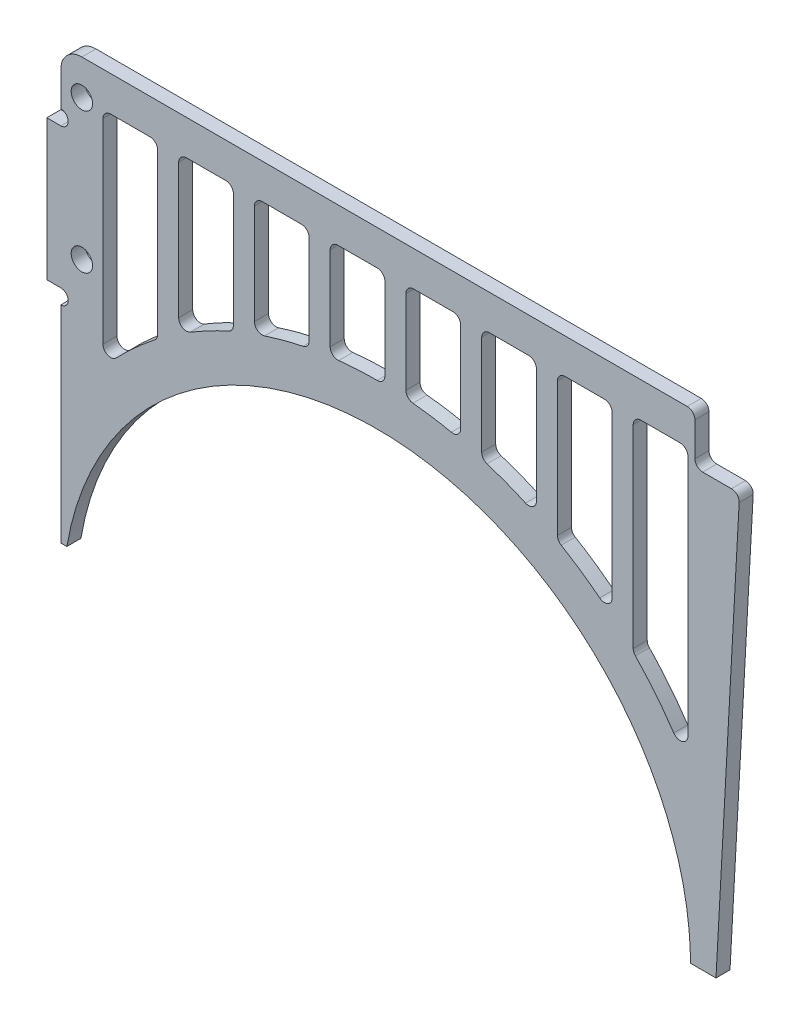
from build123d import *

# Parameters (mm, degrees)
SKETCH_1_W          = 100
SKETCH_1_H          = 68.5
EXTRUDE_1_DEPTH     = 2
SKETCH_2_RX         = 44.75
SKETCH_2_RY         = 43.805404359
CUT_EXTRUDE_1_DEPTH = 2
CUT_EXTRUDE_2_DEPTH = 2
CUT_EXTRUDE_3_DEPTH = 22
CUT_EXTRUDE_4_DEPTH = 22
SKETCH_7_W          = 4
SKETCH_7_H          = 20
EXTRUDE_2_DEPTH     = 2
SKETCH_8_R          = 1.05
CUT_EXTRUDE_5_DEPTH = 2
SKETCH_9_R          = 1.525
CUT_EXTRUDE_6_DEPTH = 10
CUT_EXTRUDE_7_DEPTH = 10
EXTRUDE_3_DEPTH     = 2
EXTRUDE_START       = -2
EXTRUDE_4_DEPTH     = 2
EXTRUDE_5_DEPTH     = 2
EXTRUDE_6_DEPTH     = 2
FILLET_1_R          = 1.1
FILLET_2_R          = 3
SKETCH_15_W         = 7.281373481
SKETCH_15_H         = 7
CUT_EXTRUDE_8_DEPTH = 2
FILLET_3_R          = 1.1


# Read off the part's stored shape, not the designer's step: 凸台-拉伸4, 凸台-拉伸6
with BuildPart() as part:
    # 草图1 → 凸台-拉伸1 (new body)
    with BuildSketch(Plane.XY):
        Rectangle(SKETCH_1_W, SKETCH_1_H)
    extrude(amount=EXTRUDE_1_DEPTH)

    # 草图2 → 切除-拉伸1 (cut)
    with BuildSketch(Plane(origin=(0, 0, 0), x_dir=(-1, 0, 0), z_dir=(0, 0, -1))):
        with Locations(Location((4.999964, -34.437161735), (0, 0, 0))):
            Ellipse(SKETCH_2_RX, SKETCH_2_RY)
    extrude(amount=-CUT_EXTRUDE_1_DEPTH, mode=Mode.SUBTRACT)

    # 草图4 → 切除-拉伸2 (cut)
    with BuildSketch(Plane(origin=(0, 0, 0), x_dir=(-1, 0, 0), z_dir=(0, 0, -1))):
        Polygon((-47.655358824, 34.25), (-47.706198649, 35.178355106), (-50, 34.25), (-50, -34.25), align=None)
    extrude(amount=-CUT_EXTRUDE_2_DEPTH, mode=Mode.SUBTRACT)

    # 草图5 → 切除-拉伸3 (cut)
    with BuildSketch(Plane.XY.offset(2)):
        Polygon((43.379483639, -34.25), (47.158744446, 34.760781725), (47.655358824, 34.25), (50, -34.25), align=None)
    extrude(amount=-CUT_EXTRUDE_3_DEPTH, mode=Mode.SUBTRACT)

    # 草图6 → 切除-拉伸4 (cut)
    with BuildSketch(Plane(origin=(0, 0, 0), x_dir=(-1, 0, 0), z_dir=(0, 0, -1))):
        Polygon((49.143541729, -27.25), (50, -27.25), (50, -34.25), (49.749555545, -34.25), align=None)
    extrude(amount=-CUT_EXTRUDE_4_DEPTH, mode=Mode.SUBTRACT)

    # 草图7 → 凸台-拉伸2 (add)
    with BuildSketch(Plane(origin=(0, 0, 0), x_dir=(-1, 0, 0), z_dir=(0, 0, -1))):
        with Locations((50, 14.25)):
            Rectangle(SKETCH_7_W, SKETCH_7_H)
    extrude(amount=-EXTRUDE_2_DEPTH)

    # 草图8 → 切除-拉伸5 (cut)
    with BuildSketch(Plane.XY.offset(2)):
        with Locations((-50, 25.3)):
            Circle(SKETCH_8_R)
        with Locations((-50, 3.2)):
            Circle(SKETCH_8_R)
    extrude(amount=-CUT_EXTRUDE_5_DEPTH, mode=Mode.SUBTRACT)

    # 草图9 → 切除-拉伸6 (cut)
    with BuildSketch(Plane.XY.offset(2)):
        with Locations((-47, 29.25)):
            Circle(SKETCH_9_R)
        with Locations((-47, 9.25)):
            Circle(SKETCH_9_R)
    extrude(amount=-CUT_EXTRUDE_6_DEPTH, mode=Mode.SUBTRACT)

    # 草图10 → 切除-拉伸7 (cut)
    with BuildSketch(Plane.XY.offset(2)):
        with BuildLine():
            Line((-44, 29.25), (-44, -2.567223492))
            add(Edge.make_bspline(
                [(-3.81025818, 15.354450248), (-5.986694547, 15.404443236), (-8.16638167, 15.317107074), (-13.44925923, 14.76944178), (-16.536678842, 14.161906764), (-22.54608951, 12.398196634), (-25.467973107, 11.242043974), (-31.046444952, 8.419417118), (-33.702926489, 6.75298171), (-38.659001153, 2.96549792), (-40.958490358, 0.844507325), (-43.365033177, -1.829750316), (-43.685254853, -2.196226228), (-44, -2.567223492)],
                knots=[0.519097747, 0.519097747, 0.519097747, 0.519097747, 0.5625, 0.5625, 0.625, 0.625, 0.6875, 0.6875, 0.75, 0.75, 0.8125, 0.8125, 0.822278277, 0.822278277, 0.822278277, 0.822278277], degree=3))
            Line((-3.81025818, 15.354450248), (-3.81025818, 29.25))
            Line((-3.81025818, 29.25), (-44, 29.25))
        make_face()
        with BuildLine():
            Line((-0.81025818, 29.25), (-0.81025818, 15.198236741))
            add(Edge.make_bspline(
                [(39.379483639, -10.277534292), (38.91730524, -9.459747753), (38.431734272, -8.6548294), (36.244902571, -5.252643432), (34.31895697, -2.796054312), (30.039934945, 1.723721123), (27.686956738, 3.78683097), (22.635743879, 7.450005366), (19.93761372, 9.050014883), (14.288996946, 11.733533492), (11.338617223, 12.817006157), (5.328339098, 14.420314397), (2.270639588, 14.947760978), (-0.81025818, 15.198236741)],
                knots=[0.168575492, 0.168575492, 0.168575492, 0.168575492, 0.1875, 0.1875, 0.25, 0.25, 0.3125, 0.3125, 0.375, 0.375, 0.4375, 0.4375, 0.499130591, 0.499130591, 0.499130591, 0.499130591], degree=3))
            Line((39.379483639, -10.277534292), (39.379483639, 29.25))
            Line((39.379483639, 29.25), (-0.81025818, 29.25))
        make_face()
    extrude(amount=-CUT_EXTRUDE_7_DEPTH, mode=Mode.SUBTRACT)

    # 草图11 → 凸台-拉伸3 (add)
    with BuildSketch(Plane.XY.offset(2)):
        with BuildLine():
            Line((-25.40512909, 29.25), (-25.40512909, 11.16510892))
            add(Edge.make_bspline(
                [(-22.40512909, 12.34757543), (-23.417465795, 11.984816348), (-24.418139406, 11.590402128), (-25.40512909, 11.16510892)],
                knots=[0.303668545, 0.303668545, 0.303668545, 0.303668545, 0.325142151, 0.325142151, 0.325142151, 0.325142151], degree=3))
            Line((-22.40512909, 12.34757543), (-22.40512909, 29.25))
            Line((-22.40512909, 29.25), (-25.40512909, 29.25))
        make_face()
    extrude(amount=-EXTRUDE_3_DEPTH)

    # 凸台-拉伸4 outline → 凸台-拉伸4 (add)
    with BuildSketch(Plane.XY.offset(2).offset(EXTRUDE_START)):
        with BuildLine():
            Line((-33.202564545, 29.25), (-36.202564545, 29.25))
            Line((-36.202564545, 29.25), (-36.202564545, 4.842723102))
            add(Edge.make_bspline(
                [(-33.202564545, 6.969798322), (-34.220704926, 6.301961185), (-35.214408449, 5.597891481), (-36.188165571, 4.853736163), (-36.195365812, 4.848230592), (-36.202564545, 4.842723102)],
                knots=[0.725621953, 0.725621953, 0.725621953, 0.725621953, 0.75, 0.75, 0.750181639, 0.750181639, 0.750181639, 0.750181639], degree=3))
            Line((-33.202564545, 6.969798322), (-33.202564545, 29.25))
        make_face()
        with BuildLine():
            Line((-11.607693635, 29.25), (-14.607693635, 29.25))
            Line((-14.607693635, 29.25), (-14.607693635, 14.467476574))
            add(Edge.make_bspline(
                [(-11.607693635, 14.944263128), (-12.612199847, 14.814769151), (-13.612788741, 14.655727806), (-14.607693635, 14.467476574)],
                knots=[0.571040051, 0.571040051, 0.571040051, 0.571040051, 0.591236782, 0.591236782, 0.591236782, 0.591236782], degree=3))
            Line((-11.607693635, 14.944263128), (-11.607693635, 29.25))
        make_face()
    extrude(amount=EXTRUDE_4_DEPTH)

    # 草图13 → 凸台-拉伸5 (add)
    with BuildSketch(Plane.XY.offset(2)):
        with BuildLine():
            Line((17.784612729, 29.25), (17.784612729, 10.066819459))
            add(Edge.make_bspline(
                [(20.784612729, 8.461098542), (19.80320325, 9.029239366), (18.802464276, 9.564904962), (17.784612729, 10.066819459)],
                knots=[0.679636333, 0.679636333, 0.679636333, 0.679636333, 0.702324234, 0.702324234, 0.702324234, 0.702324234], degree=3))
            Line((20.784612729, 8.461098542), (20.784612729, 29.25))
            Line((20.784612729, 29.25), (17.784612729, 29.25))
        make_face()
    extrude(amount=-EXTRUDE_5_DEPTH)

    # 凸台-拉伸6 outline → 凸台-拉伸6 (add)
    with BuildSketch(Plane.XY.offset(2).offset(EXTRUDE_START)):
        with BuildLine():
            Line((9.987177274, 29.25), (6.987177274, 29.25))
            Line((6.987177274, 29.25), (6.987177274, 13.959000651))
            add(Edge.make_bspline(
                [(9.987177274, 13.146989422), (9.431746552, 13.315499348), (8.873390811, 13.474632599), (7.872227096, 13.741704106), (7.430422175, 13.853288271), (6.987177274, 13.959000651)],
                knots=[0.425914451, 0.425914451, 0.425914451, 0.425914451, 0.4375, 0.4375, 0.446591538, 0.446591538, 0.446591538, 0.446591538], degree=3))
            Line((9.987177274, 13.146989422), (9.987177274, 29.25))
        make_face()
        with BuildLine():
            Line((31.582048184, 29.25), (28.582048184, 29.25))
            Line((28.582048184, 29.25), (28.582048184, 2.904921367))
            add(Edge.make_bspline(
                [(31.582048184, 0.084073919), (30.621637038, 1.064215174), (29.620470689, 2.005489958), (28.582048184, 2.904921367)],
                knots=[0.255764385, 0.255764385, 0.255764385, 0.255764385, 0.283317563, 0.283317563, 0.283317563, 0.283317563], degree=3))
            Line((31.582048184, 0.084073919), (31.582048184, 29.25))
        make_face()
    extrude(amount=EXTRUDE_6_DEPTH)

    # 圆角1
    fillet_1_edges = [part.edges().sort_by_distance(p)[0] for p in [
        (-44, 29.25, 1),
        (-36.202564545, 29.25, 1),
        (-36.202564545, 4.842723102, 1),
        (-44, -2.567223492, 1),
        (-0.81025818, 29.25, 1),
        (6.987177274, 29.25, 1),
        (6.987177274, 13.959000651, 1),
        (-0.81025818, 15.198236741, 1),
        (-22.40512909, 29.25, 1),
        (-14.607693635, 29.25, 1),
        (-14.607693635, 14.467476574, 1),
        (-22.40512909, 12.34757543, 1),
        (-33.202564545, 29.25, 1),
        (-25.40512909, 29.25, 1),
        (-25.40512909, 11.16510892, 1),
        (-33.202564545, 6.969798322, 1),
        (-11.607693635, 29.25, 1),
        (-3.81025818, 29.25, 1),
        (-3.81025818, 15.354450248, 1),
        (-11.607693635, 14.944263128, 1),
        (20.784612729, 29.25, 1),
        (28.582048184, 29.25, 1),
        (28.582048184, 2.904921367, 1),
        (9.987177274, 29.25, 1),
        (17.784612729, 29.25, 1),
        (17.784612729, 10.066819459, 1),
        (9.987177274, 13.146989422, 1),
        (20.784612729, 8.461098542, 1),
        (31.582048184, 29.25, 1),
        (39.379483639, 29.25, 1),
        (31.582048184, 0.084073919, 1),
        (39.379483639, -10.277534292, 1),
    ]]
    fillet(fillet_1_edges, radius=FILLET_1_R)

    # 圆角2
    fillet_2_edges = [part.edges().sort_by_distance(p)[0] for p in [
        (47.130772333, 34.25, 1),
        (-50, 34.25, 1),
    ]]
    fillet(fillet_2_edges, radius=FILLET_2_R)

    # 草图15 → 切除-拉伸8 (cut)
    with BuildSketch(Plane(origin=(0, 0, 0), x_dir=(-1, 0, 0), z_dir=(0, 0, -1))):
        with Locations((-44.02017038, 30.75)):
            Rectangle(SKETCH_15_W, SKETCH_15_H)
    extrude(amount=-CUT_EXTRUDE_8_DEPTH, mode=Mode.SUBTRACT)

    # 圆角3
    fillet_3_edges = [part.edges().sort_by_distance(p)[0] for p in [
        (46.747428963, 27.25, 1),
        (40.379483639, 27.25, 1),
        (40.379483639, 34.25, 1),
    ]]
    fillet(fillet_3_edges, radius=FILLET_3_R)


solid = part.part
